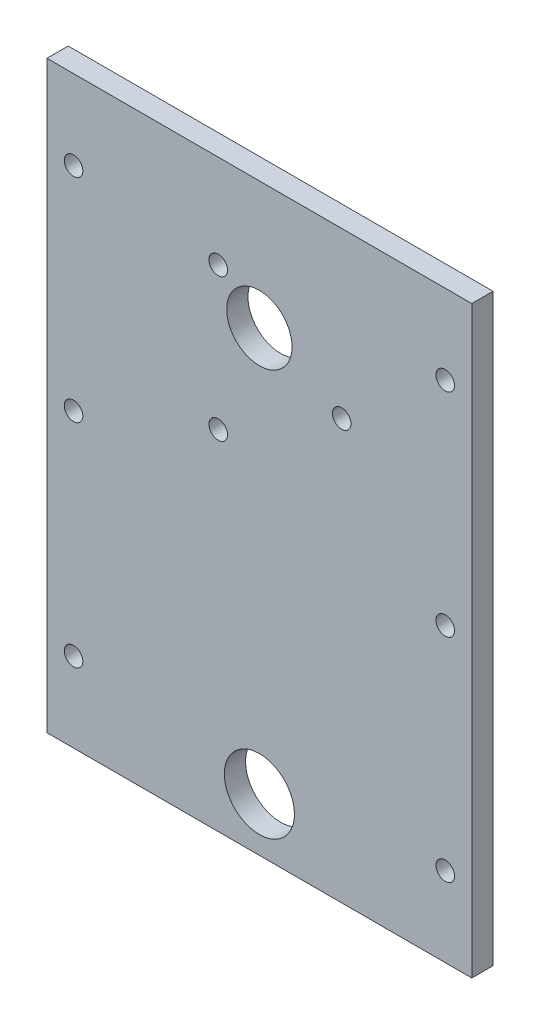
from build123d import *

# Parameters (mm, degrees)
SKETCH_1_R      = 1.75
EXTRUDE_1_DEPTH = 4


with BuildPart() as part:
    # ｽｹｯﾁ1 → ﾎﾞｽ - 押し出し1 (new body)
    with BuildSketch(Plane.XY):
        Polygon((0, 0), (40, 0), (80, 0), (80, 110), (0, 110), align=None)
        with Locations((5, 95)):
            Circle(SKETCH_1_R, mode=Mode.SUBTRACT)
        with Locations((75, 15)):
            Circle(SKETCH_1_R, mode=Mode.SUBTRACT)
        with Locations((5, 15)):
            Circle(SKETCH_1_R, mode=Mode.SUBTRACT)
        with BuildLine():
            ThreePointArc((40, 3.4), (33.4, 10), (40, 16.6))
            ThreePointArc((40, 16.6), (46.6, 10), (40, 3.4))
        make_face(mode=Mode.SUBTRACT)
        with Locations((5, 55)):
            Circle(SKETCH_1_R, mode=Mode.SUBTRACT)
        with Locations((32.25, 65.576606241)):
            Circle(SKETCH_1_R, mode=Mode.SUBTRACT)
        with Locations((32.25, 92.423393759)):
            Circle(SKETCH_1_R, mode=Mode.SUBTRACT)
        with Locations((55.5, 79)):
            Circle(SKETCH_1_R, mode=Mode.SUBTRACT)
        with Locations((75, 55)):
            Circle(SKETCH_1_R, mode=Mode.SUBTRACT)
        with BuildLine():
            ThreePointArc((39.497374059, 79.870573668), (34.673943767, 82.925), (34.440448115, 88.629426332))
            ThreePointArc((34.440448115, 88.629426332), (45.326056233, 89.075), (39.497374059, 79.870573668))
        make_face(mode=Mode.SUBTRACT)
        with Locations((75, 95)):
            Circle(SKETCH_1_R, mode=Mode.SUBTRACT)
    extrude(amount=EXTRUDE_1_DEPTH)


solid = part.part
